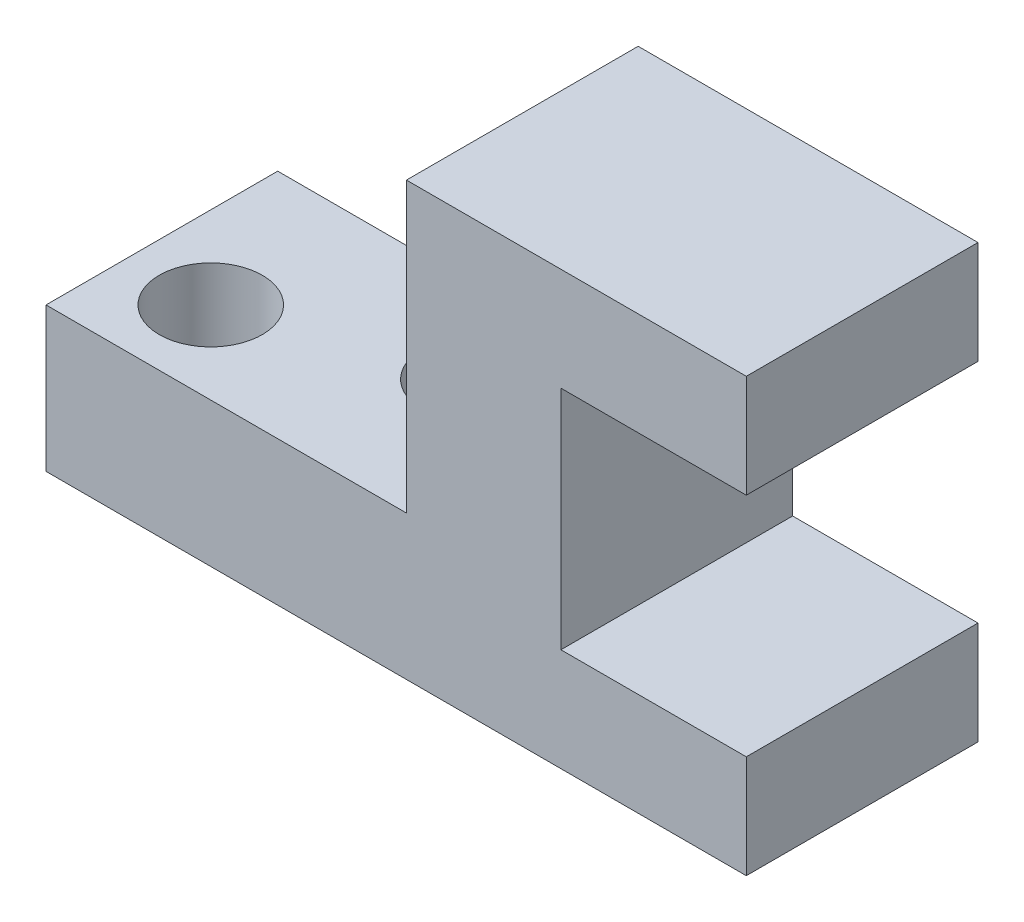
from build123d import *

# Parameters (mm, degrees)
BOSS_EXTRUDE1_DEPTH = 4.5
SKETCH2_R           = 1
CUT_EXTRUDE1_DEPTH  = 10


with BuildPart() as part:
    # Sketch1 → Boss-Extrude1 (new body)
    with BuildSketch(Plane.XY):
        Polygon((0, 0), (-13.6, 0), (-13.6, 2.8), (-6.6, 2.8), (-6.6, 8.4), (0, 8.4), (0, 6.4), (-3.6, 6.4), (-3.6, 2), (0, 2), align=None)
    extrude(amount=BOSS_EXTRUDE1_DEPTH)

    # Sketch2 → Cut-Extrude1 (cut)
    with BuildSketch(Plane(origin=(0, 2.8, 0), x_dir=(1, 0, 0), z_dir=(0, 1, 0))):
        with Locations((-8.2, -1.6)):
            Circle(SKETCH2_R)
        with Locations((-12, -2.9)):
            Circle(SKETCH2_R)
    extrude(amount=-CUT_EXTRUDE1_DEPTH, mode=Mode.SUBTRACT)


solid = part.part
